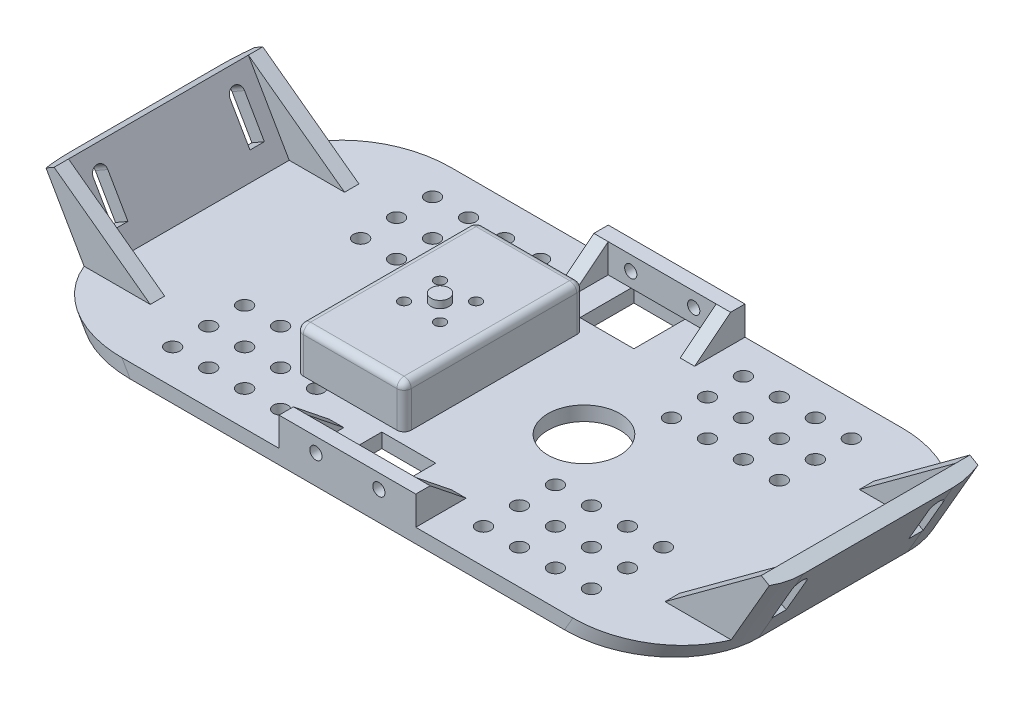
from build123d import *

# Parameters (mm, degrees)
SKETCH_1_W               = 200
SKETCH_1_H               = 4
EXTRUDE_1_DEPTH          = 45.75
SKETCH_2_W               = 30
SKETCH_2_H               = 8
SKETCH_2_R               = 1.7
EXTRUDE_2_DEPTH          = 4
EXTRUDE_3_DEPTH          = 4
EXTRUDE_4_DEPTH          = 4
CUT_EXTRUDE_1_DEPTH      = 64.8
SKETCH_6_W               = 50
SKETCH_6_H               = 25
EXTRUDE_5_DEPTH          = 4
EXTRUDE_6_DEPTH          = 4
EXTRUDE_7_DEPTH          = 4
FILLET_1_R               = 25
SKETCH_12_R              = 2
SKETCH_12_W              = 15
SKETCH_12_H              = 15
CUT_EXTRUDE_5_DEPTH      = 13
SKETCH_22_W              = 30
SKETCH_22_H              = 50
EXTRUDE_13_DEPTH         = 12
CUT_EXTRUDE_7_DEPTH      = 113.684775796
CUT_EXTRUDE_7_DEPTH_BACK = 113.684775796
SKETCH_21_R              = 1.5
SKETCH_21_R_2            = 10
SKETCH_21_3_R            = 2.5
EXTRUDE_12_DEPTH         = 2
CUT_EXTRUDE_8_DEPTH      = 7
CUT_EXTRUDE_8_DEPTH_BACK = 114.260788239
SKETCH_22_3_W            = 20
SKETCH_22_3_H            = 40
FILLET_4_R               = 2


with BuildPart() as part:
    # 草图1 → 凸台-拉伸1 (new body)
    with BuildSketch(Plane.XY):
        with Locations((0, -35.772823494)):
            Rectangle(SKETCH_1_W, SKETCH_1_H)
    extrude(amount=-EXTRUDE_1_DEPTH)

    # 草图2 → 凸台-拉伸2 (add)
    with BuildSketch(Plane(origin=(0, 0, -45.75), x_dir=(-1, 0, 0), z_dir=(0, 0, -1))):
        with Locations((0, -29.772823494)):
            Rectangle(SKETCH_2_W, SKETCH_2_H)
        with Locations((-8.75, -29.772823494)):
            Circle(SKETCH_2_R, mode=Mode.SUBTRACT)
        with Locations((8.75, -29.772823494)):
            Circle(SKETCH_2_R, mode=Mode.SUBTRACT)
    extrude(amount=-EXTRUDE_2_DEPTH)

    # 草图3 → 凸台-拉伸3 (add)
    with BuildSketch(Plane.ZY.offset(15)):
        Polygon((-41.75, -25.772823494), (-31.75, -33.772823494), (-41.75, -33.772823494), (-45.75, -33.772823494), (-45.75, -25.772823494), align=None)
    extrude(amount=EXTRUDE_3_DEPTH)

    # 草图4 → 凸台-拉伸4 (add)
    with BuildSketch(Plane(origin=(15, 0, 0), x_dir=(0, 0, -1), z_dir=(1, 0, 0))):
        Polygon((41.75, -25.772823494), (31.75, -33.772823494), (41.75, -33.772823494), (45.75, -33.772823494), (45.75, -25.772823494), align=None)
    extrude(amount=EXTRUDE_4_DEPTH)

    # 草图5 → 切除-拉伸1 (cut)
    with BuildSketch(Plane(origin=(0, 0, -45.75), x_dir=(-1, 0, 0), z_dir=(0, 0, -1))):
        Polygon((97.073293463, -24.186165895), (87.620335894, -40.559168687), (102.543784548, -40.56957643), (102.543784548, -24.186165895), align=None)
        Polygon((-102.543784548, -24.186165895), (-97.073293463, -24.186165895), (-87.620335894, -40.559168687), (-102.543784548, -40.56957643), align=None)
    extrude(amount=-CUT_EXTRUDE_1_DEPTH, mode=Mode.SUBTRACT)

    # 镜向1: part across plane


with BuildPart() as part_1:
    add(part.part)
    add(part.part.mirror(Plane(origin=(0, 0, 0), x_dir=(1, 0, 0), z_dir=(0, 0, -1))))

    # 草图6 → 凸台-拉伸5 (add)
    with BuildSketch(Plane(origin=(-83.27788714, -48.080510558, 0), x_dir=(0, 0, 1), z_dir=(-0.8660254037844379, -0.5000000000000013, 0))):
        with Locations((0, 24.402291802)):
            Rectangle(SKETCH_6_W, SKETCH_6_H)
        with BuildLine():
            Line((-21, 31.04221993), (-21, 20.01920141))
            Line((-21, 20.01920141), (-17, 20.01920141))
            Line((-17, 20.01920141), (-17, 31.04221993))
            ThreePointArc((-17, 31.04221993), (-19, 33.04221993), (-21, 31.04221993))
        make_face(mode=Mode.SUBTRACT)
        with BuildLine():
            Line((17, 31.04221993), (17, 19.844232862))
            Line((17, 19.844232862), (21, 19.844232862))
            Line((21, 19.844232862), (21, 31.04221993))
            ThreePointArc((21, 31.04221993), (19, 33.04221993), (17, 31.04221993))
        make_face(mode=Mode.SUBTRACT)
    extrude_5 = extrude(amount=-EXTRUDE_5_DEPTH)

    # 草图7 → 凸台-拉伸6 (add)
    with BuildSketch(Plane.XY.offset(25)):
        Polygon((-91.538434118, -33.772823494), (-101.729033041, -16.122188399), (-98.264931426, -14.122188399), (-71.538434118, -33.772823494), align=None)
    extrude_6 = extrude(amount=EXTRUDE_6_DEPTH)

    # 草图8 → 凸台-拉伸7 (add)
    with BuildSketch(Plane(origin=(0, 0, -25), x_dir=(-1, 0, 0), z_dir=(0, 0, -1))):
        Polygon((91.538434118, -33.772823494), (101.729033041, -16.122188399), (98.264931426, -14.122188399), (71.538434118, -33.772823494), align=None)
    extrude_7 = extrude(amount=EXTRUDE_7_DEPTH)

    # 镜向2: 凸台-拉伸5, 凸台-拉伸6, 凸台-拉伸7 across plane
    add(extrude_5.mirror(Plane(origin=(0, 0, 0), x_dir=(0, 0, 1), z_dir=(1, 0, 0))))
    add(extrude_6.mirror(Plane(origin=(0, 0, 0), x_dir=(0, 0, 1), z_dir=(1, 0, 0))))
    add(extrude_7.mirror(Plane(origin=(0, 0, 0), x_dir=(0, 0, 1), z_dir=(1, 0, 0))))

    # 圆角1
    # the kernel refuses this fillet: 25 mm, written as the material it takes off along each edge
    with BuildSketch(Plane(origin=(122.788434118, 20.353764243, 45.75), x_dir=(-0.8660254037844383, 0.5000000000000007, 0), z_dir=(-0.5000000000000008, -0.8660254037844383, 0)), Plane(origin=(-122.788434118, 20.353764243, 45.75), x_dir=(0, 0, -1), z_dir=(0.5000000000000002, -0.8660254037844386, 0)), Plane(origin=(-122.788434118, 20.353764243, -45.75), x_dir=(0.8660254037844385, 0.5000000000000002, 0), z_dir=(0.5000000000000002, -0.8660254037844386, 0))) as fillet_1_piece_1:
        with BuildLine():
            CenterArc((FILLET_1_R, FILLET_1_R), FILLET_1_R, 180, 90)
            Line((0, FILLET_1_R), (0, 0))
            Line((0, 0), (FILLET_1_R, 0))
        make_face()
    extrude(amount=129.618802154, mode=Mode.SUBTRACT)
    with BuildSketch(Plane(origin=(122.788434118, 20.353764243, -45.75), x_dir=(-0.8660254037844383, 0.5000000000000008, 0), z_dir=(-0.5000000000000008, -0.8660254037844383, 0))) as fillet_1_piece_2:
        with BuildLine():
            CenterArc((FILLET_1_R, -FILLET_1_R), FILLET_1_R, 90, 90)
            Line((0, -FILLET_1_R), (0, 0))
            Line((0, 0), (FILLET_1_R, 0))
        make_face()
    extrude(amount=129.618802154, mode=Mode.SUBTRACT)

    # 草图12 → 切除-拉伸5 (cut)
    with BuildSketch(Plane(origin=(0, -33.772823494, 0), x_dir=(1, 0, 0), z_dir=(0, 1, 0))):
        with Locations(Location((58.196758832, 36.119111303, 0), (0, 0, 180))):
            Circle(SKETCH_12_R)
        with Locations(Location((48.196758832, 36.119111303, 0), (0, 0, 180))):
            Circle(SKETCH_12_R)
        with Locations(Location((38.196758832, 36.119111303, 0), (0, 0, 180))):
            Circle(SKETCH_12_R)
        with Locations(Location((28.196758832, 36.119111303, 0), (0, 0, 180))):
            Circle(SKETCH_12_R)
        with Locations(Location((48.196758832, 26.119111303, 0), (0, 0, 180))):
            Circle(SKETCH_12_R)
        with Locations(Location((38.196758832, 26.119111303, 0), (0, 0, 180))):
            Circle(SKETCH_12_R)
        with Locations(Location((28.196758832, 26.119111303, 0), (0, 0, 180))):
            Circle(SKETCH_12_R)
        with Locations(Location((48.196758832, 16.119111303, 0), (0, 0, 180))):
            Circle(SKETCH_12_R)
        with Locations(Location((38.196758832, 16.119111303, 0), (0, 0, 180))):
            Circle(SKETCH_12_R)
        with Locations(Location((28.196758832, 16.119111303, 0), (0, 0, 180))):
            Circle(SKETCH_12_R)
        with Locations(Location((58.196758832, 26.119111303, 0), (0, 0, 180))):
            Circle(SKETCH_12_R)
        with Locations(Location((58.196758832, 16.119111303, 0), (0, 0, 180))):
            Circle(SKETCH_12_R)
        with Locations((-58.196758832, 16.119111303)):
            Circle(SKETCH_12_R)
        with Locations((-58.196758832, 26.119111303)):
            Circle(SKETCH_12_R)
        with Locations((-28.196758832, 16.119111303)):
            Circle(SKETCH_12_R)
        with Locations((-38.196758832, 16.119111303)):
            Circle(SKETCH_12_R)
        with Locations((-48.196758832, 16.119111303)):
            Circle(SKETCH_12_R)
        with Locations((-28.196758832, 26.119111303)):
            Circle(SKETCH_12_R)
        with Locations((-38.196758832, 26.119111303)):
            Circle(SKETCH_12_R)
        with Locations((-48.196758832, 26.119111303)):
            Circle(SKETCH_12_R)
        with Locations((-28.196758832, 36.119111303)):
            Circle(SKETCH_12_R)
        with Locations((-38.196758832, 36.119111303)):
            Circle(SKETCH_12_R)
        with Locations((-48.196758832, 36.119111303)):
            Circle(SKETCH_12_R)
        with Locations((-58.196758832, 36.119111303)):
            Circle(SKETCH_12_R)
        with Locations(Location((-58.196758832, -36.119111303, 0), (0, 0, 180))):
            Circle(SKETCH_12_R)
        with Locations(Location((-48.196758832, -36.119111303, 0), (0, 0, 180))):
            Circle(SKETCH_12_R)
        with Locations(Location((-38.196758832, -36.119111303, 0), (0, 0, 180))):
            Circle(SKETCH_12_R)
        with Locations(Location((-28.196758832, -36.119111303, 0), (0, 0, 180))):
            Circle(SKETCH_12_R)
        with Locations(Location((-48.196758832, -26.119111303, 0), (0, 0, 180))):
            Circle(SKETCH_12_R)
        with Locations(Location((-38.196758832, -26.119111303, 0), (0, 0, 180))):
            Circle(SKETCH_12_R)
        with Locations(Location((-28.196758832, -26.119111303, 0), (0, 0, 180))):
            Circle(SKETCH_12_R)
        with Locations(Location((-48.196758832, -16.119111303, 0), (0, 0, 180))):
            Circle(SKETCH_12_R)
        with Locations(Location((-38.196758832, -16.119111303, 0), (0, 0, 180))):
            Circle(SKETCH_12_R)
        with Locations(Location((-28.196758832, -16.119111303, 0), (0, 0, 180))):
            Circle(SKETCH_12_R)
        with Locations(Location((-58.196758832, -26.119111303, 0), (0, 0, 180))):
            Circle(SKETCH_12_R)
        with Locations(Location((-58.196758832, -16.119111303, 0), (0, 0, 180))):
            Circle(SKETCH_12_R)
        with Locations((58.196758832, -16.119111303)):
            Circle(SKETCH_12_R)
        with Locations((58.196758832, -26.119111303)):
            Circle(SKETCH_12_R)
        with Locations((28.196758832, -16.119111303)):
            Circle(SKETCH_12_R)
        with Locations((38.196758832, -16.119111303)):
            Circle(SKETCH_12_R)
        with Locations((48.196758832, -16.119111303)):
            Circle(SKETCH_12_R)
        with Locations((28.196758832, -26.119111303)):
            Circle(SKETCH_12_R)
        with Locations((38.196758832, -26.119111303)):
            Circle(SKETCH_12_R)
        with Locations((48.196758832, -26.119111303)):
            Circle(SKETCH_12_R)
        with Locations((28.196758832, -36.119111303)):
            Circle(SKETCH_12_R)
        with Locations((38.196758832, -36.119111303)):
            Circle(SKETCH_12_R)
        with Locations((48.196758832, -36.119111303)):
            Circle(SKETCH_12_R)
        with Locations((58.196758832, -36.119111303)):
            Circle(SKETCH_12_R)
        with Locations((-1.155156202, -35.031984266)):
            Rectangle(SKETCH_12_W, SKETCH_12_H)
        with Locations((-1.155156202, 35.031984266)):
            Rectangle(SKETCH_12_W, SKETCH_12_H)
    extrude(amount=-CUT_EXTRUDE_5_DEPTH, mode=Mode.SUBTRACT)

    # 草图22 → 凸台-拉伸13 (add)
    with BuildSketch(Plane(origin=(0, -33.772823494, 0), x_dir=(1, 0, 0), z_dir=(0, 1, 0))):
        with Locations((-20, 0)):
            Rectangle(SKETCH_22_W, SKETCH_22_H)
    extrude(amount=EXTRUDE_13_DEPTH)

    # 草图21 → 切除-拉伸7 (cut, two sides: drawn at the far end of the back side and taken through both)
    with BuildSketch(Plane(origin=(0, -21.772823494, 0), x_dir=(1, 0, 0), z_dir=(0, 1, 0)).offset(-CUT_EXTRUDE_7_DEPTH_BACK)):
        with Locations(Location((-25, 5, 0), (0, 0, 180))):
            Circle(SKETCH_21_R)
        with Locations(Location((-15, 5, 0), (0, 0, 180))):
            Circle(SKETCH_21_R)
        with Locations(Location((-15, -5, 0), (0, 0, 180))):
            Circle(SKETCH_21_R)
        with Locations(Location((-25, -5, 0), (0, 0, 180))):
            Circle(SKETCH_21_R)
        with Locations(Location((20, 0, 0), (0, 0, 180))):
            Circle(SKETCH_21_R_2)
    extrude(amount=CUT_EXTRUDE_7_DEPTH + CUT_EXTRUDE_7_DEPTH_BACK, mode=Mode.SUBTRACT)

    # 草图21<3> → 凸台-拉伸12 (add)
    with BuildSketch(Plane(origin=(0, -21.772823494, 0), x_dir=(1, 0, 0), z_dir=(0, 1, 0))):
        with Locations((-20, 0)):
            Circle(SKETCH_21_3_R)
    extrude(amount=EXTRUDE_12_DEPTH)

    # 草图22<3> → 切除-拉伸8 (cut, two sides: drawn at the far end of the back side and taken through both)
    with BuildSketch(Plane(origin=(0, -33.772823494, 0), x_dir=(1, 0, 0), z_dir=(0, 1, 0)).offset(-CUT_EXTRUDE_8_DEPTH_BACK)):
        with Locations((-20, 0)):
            Rectangle(SKETCH_22_3_W, SKETCH_22_3_H)
    extrude(amount=CUT_EXTRUDE_8_DEPTH + CUT_EXTRUDE_8_DEPTH_BACK, mode=Mode.SUBTRACT)

    # 圆角4
    fillet_4_edges = [part_1.edges().sort_by_distance(p)[0] for p in [
        (-20, -21.772823494, -25),
        (-5, -27.772823494, -25),
        (-35, -27.772823494, -25),
        (-35, -27.772823494, 25),
        (-5, -21.772823494, 0),
        (-5, -27.772823494, 25),
        (-35, -21.772823494, 0),
        (-20, -21.772823494, 25),
    ]]
    fillet(fillet_4_edges, radius=FILLET_4_R)


solid = part_1.part
